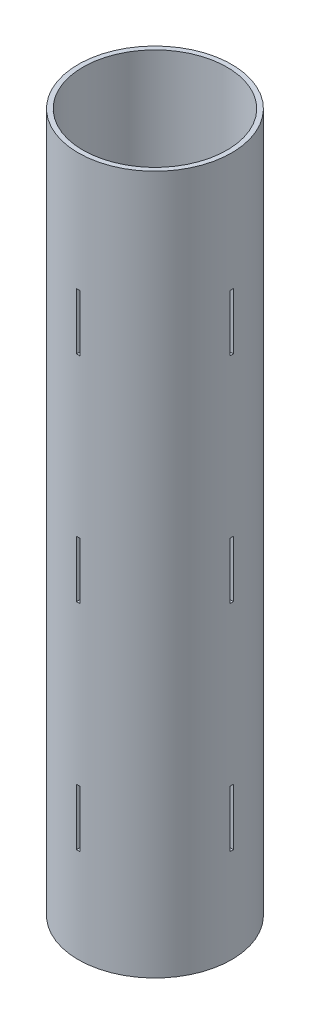
from build123d import *

# Parameters (mm, degrees)
SKETCH1_R           = 32.5
SKETCH1_R_2         = 30.5
BOSS_EXTRUDE1_DEPTH = 296
SKETCH2_W           = 1.5
SKETCH2_H           = 24
CUT_EXTRUDE1_DEPTH  = 50
SKETCH3_W           = 1.5
SKETCH3_H           = 24
CUT_EXTRUDE2_DEPTH  = 50


with BuildPart() as part:
    # Sketch1 → Boss-Extrude1 (new body)
    with BuildSketch(Plane(origin=(0, 0, 0), x_dir=(1, 0, 0), z_dir=(0, 1, 0))):
        Circle(SKETCH1_R)
        Circle(SKETCH1_R_2, mode=Mode.SUBTRACT)
    extrude(amount=BOSS_EXTRUDE1_DEPTH)

    # Sketch2 → Cut-Extrude1 (cut, symmetric)
    with BuildSketch(Plane(origin=(0, 0, 0), x_dir=(0, 0, -1), z_dir=(1, 0, 0))):
        with Locations((0, 233.879808483)):
            Rectangle(SKETCH2_W, SKETCH2_H)
        with Locations((0, 143)):
            Rectangle(SKETCH2_W, SKETCH2_H)
        with Locations((0, 52)):
            Rectangle(SKETCH2_W, SKETCH2_H)
    extrude(amount=CUT_EXTRUDE1_DEPTH, both=True, mode=Mode.SUBTRACT)

    # Sketch3 → Cut-Extrude2 (cut, symmetric)
    with BuildSketch(Plane.XY):
        with Locations((0, 233.879808483)):
            Rectangle(SKETCH3_W, SKETCH3_H)
        with Locations((0, 143)):
            Rectangle(SKETCH3_W, SKETCH3_H)
        with Locations((0, 52)):
            Rectangle(SKETCH3_W, SKETCH3_H)
    extrude(amount=CUT_EXTRUDE2_DEPTH, both=True, mode=Mode.SUBTRACT)


solid = part.part
